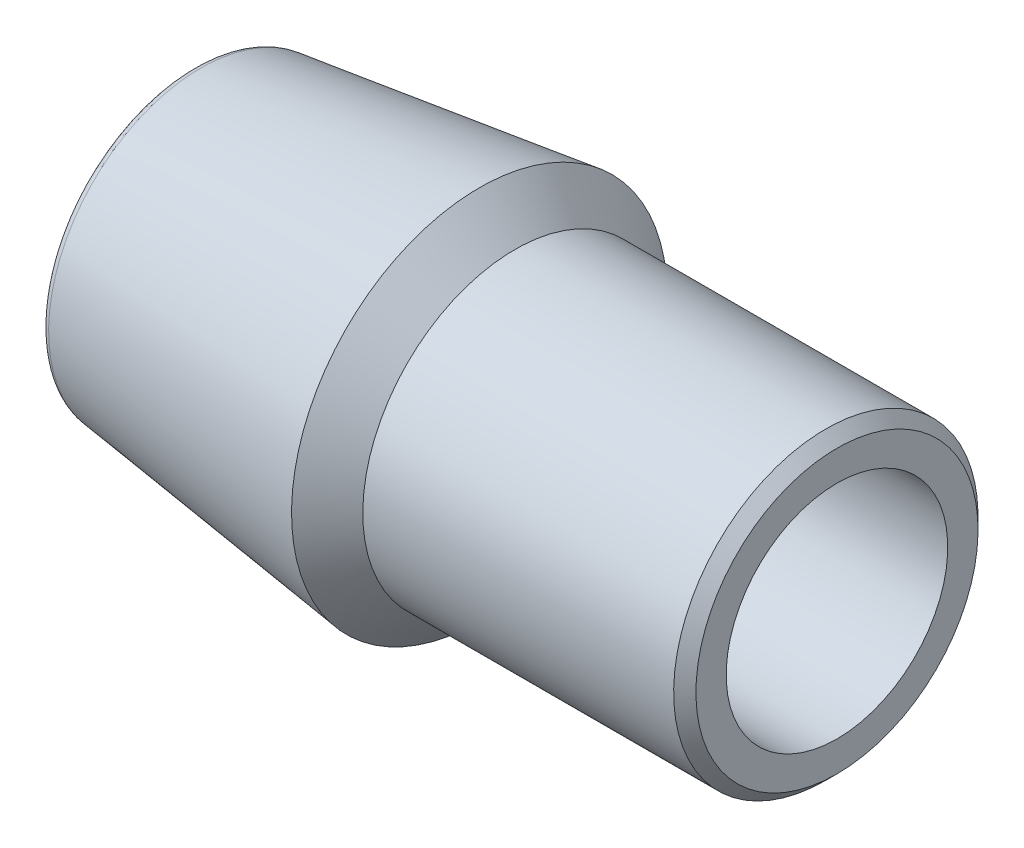
from build123d import *

# Parameters (mm, degrees)
SWEEP1_PITCH = 1.058333333


with BuildPart() as part:
    # Sketch2 → Revolve1 (revolve)
    with BuildSketch(Plane.XY, mode=Mode.PRIVATE) as revolve1_sk:
        with BuildLine():
            Line((-19.05, 4.7625), (-19.05, 8.481509473))
            ThreePointArc((-19.05, 8.481509473), (-18.91856737, 8.829745885), (-18.589821273, 9.0043))
            Line((-18.589821273, 9.0043), (-2.1082, 11.1125))
            Line((-2.1082, 11.1125), (0, 9.0043))
            Line((0, 9.0043), (18.3911875, 9.0043))
            Line((18.3911875, 9.0043), (19.05, 8.3454875))
            Line((19.05, 8.3454875), (19.05, 6.55399375))
            Line((19.05, 6.55399375), (5.10460625, 6.55399375))
            ThreePointArc((5.10460625, 6.55399375), (4.871680857, 6.457512893), (4.7752, 6.2245875))
            Line((4.7752, 6.2245875), (4.7752, 4.7625))
            Line((4.7752, 4.7625), (-19.05, 4.7625))
        make_face()
    revolve(revolve1_sk.sketch.rotate(Axis((-19.05, 0, 0), (1, 0, 0)), 180), axis=Axis((-19.05, 0, 0), (1, 0, 0)))

    # Sweep1: the profile of Sketch5 screwed along a right-hand helix of 23.512 turns, 8 arcs to a turn; built about Z, then put on its axis
    sweep1_z = Axis((0, 0, 0), (0, 0, 1))
    sweep1_corners = [(4.819783972, 0, -0.959114583), (4.819783972, 0, 0.033072917), (4.075092336, 0, -0.396875), (4.075092336, 0, -0.529166667)]
    with BuildLine(mode=Mode.PRIVATE) as sweep1_profile:
        Line(sweep1_corners[0], sweep1_corners[1])
        Line(sweep1_corners[1], sweep1_corners[2])
        Line(sweep1_corners[2], sweep1_corners[3])
        Line(sweep1_corners[3], sweep1_corners[0])
    sweep1_cap = Face(sweep1_profile.wire())
    sweep1_turn_angles = [0, 22.5, 45, 67.5, 90, 112.5, 135, 157.5, 180, 202.5, 225, 247.5, 270, 292.5, 315, 337.5, 360]
    sweep1_turn_weights = [1, 0.9238795325112867, 1, 0.9238795325112867, 1, 0.9238795325112867, 1, 0.9238795325112867, 1, 0.9238795325112867, 1, 0.9238795325112867, 1, 0.9238795325112867, 1, 0.9238795325112867, 1]
    sweep1_turn_rails = [Edge.make_bspline([Vector(p[0], p[1], 0).rotate(sweep1_z, sweep1_turn_angles[k]) / sweep1_turn_weights[k] + Vector(0, 0, p[2] + SWEEP1_PITCH * sweep1_turn_angles[k] / 360) for k in range(17)], [0, 0, 0, 1, 1, 2, 2, 3, 3, 4, 4, 5, 5, 6, 6, 7, 7, 8, 8, 8], 2, sweep1_turn_weights) for p in sweep1_corners]
    sweep1_turn_sides = [Face.make_surface_from_curves(sweep1_turn_rails[p[0]], sweep1_turn_rails[p[1]]) for p in [(0, 1), (1, 2), (2, 3), (3, 0)]]
    sweep1_last_angles = [8280, 8302.5, 8325, 8347.5, 8370, 8392.5, 8415, 8437.5, 8460, 8462.16, 8464.32]
    sweep1_last_weights = [1, 0.9238795325112867, 1, 0.9238795325112867, 1, 0.9238795325112867, 1, 0.9238795325112867, 1, 0.9992894726406043, 1]
    sweep1_last_rails = [Edge.make_bspline([Vector(p[0], p[1], 0).rotate(sweep1_z, sweep1_last_angles[k]) / sweep1_last_weights[k] + Vector(0, 0, p[2] + SWEEP1_PITCH * sweep1_last_angles[k] / 360) for k in range(11)], [0, 0, 0, 1, 1, 2, 2, 3, 3, 4, 4, 5, 5, 5], 2, sweep1_last_weights) for p in sweep1_corners]
    sweep1_last_sides = [Face.make_surface_from_curves(sweep1_last_rails[p[0]], sweep1_last_rails[p[1]]) for p in [(0, 1), (1, 2), (2, 3), (3, 0)]]
    sweep1 = Plane(origin=(-19.05, 0, 0), x_dir=(0, 1, 0), z_dir=(1, 0, 0)) * Solid(Shell([*[p.moved(Location((0, 0, SWEEP1_PITCH * i))) for i in range(23) for p in sweep1_turn_sides], *sweep1_last_sides, sweep1_cap, sweep1_cap.rotate(sweep1_z, 8464.32).moved(Location((0, 0, SWEEP1_PITCH * 8464.32 / 360)))]))
    add(sweep1)

    # Sketch6 → Cut-Revolve1 (revolve, cut)
    with BuildSketch(Plane.XY, mode=Mode.PRIVATE) as cut_revolve1_sk:
        Polygon((-20.0421875, 4.877067944), (-19.05, 4.877067944), (-19.05, 4.7625), (-18.248024392, 3.960524392), (-20.0421875, 3.960524392), align=None)
        Polygon((4.7752, 4.819783972), (3.91594042, 3.960524392), (19.05, 3.960524392), (19.05, 4.819783972), align=None)
    revolve(cut_revolve1_sk.sketch.rotate(Axis((-19.05, 0, 0), (1, 0, 0)), 66.045477075), axis=Axis((-19.05, 0, 0), (1, 0, 0)), mode=Mode.SUBTRACT)


solid = part.part
